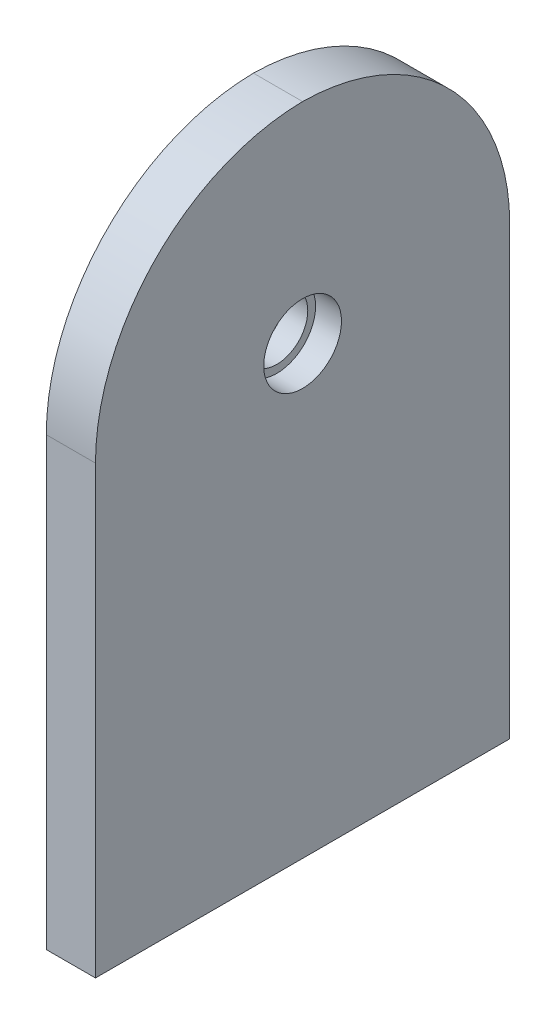
from build123d import *

# Parameters (mm, degrees)
STOCK_NEW_TRACKER_1_START = 60
STOCK_NEW_TRACKER_1_DEPTH = 8
SKETCH1_R                 = 7.509
CUT_EXTRUDE1_DEPTH        = 5
SKETCH2_R                 = 6
CUT_EXTRUDE2_DEPTH        = 143.418251296
BOSS_EXTRUDE1_START       = 1.5
SKETCH6_R                 = 6
BOSS_EXTRUDE1_DEPTH       = 1.5
M4X0_7_TAPPED_HOLE1_D     = 3.3
M4X0_7_TAPPED_HOLE1_DEPTH = 35
M4X0_7_TAPPED_HOLE1_TIP   = 0.991420021


# Read off the part's stored shape, not the designer's step: Stock-New_Tracker-1
with BuildPart() as part:
    # Stock-New_Tracker-1 outline → Stock-New_Tracker-1 (new body)
    with BuildSketch(Plane.YZ.offset(STOCK_NEW_TRACKER_1_START)):
        with BuildLine():
            Line((10, 40), (10, -40))
            Line((10, -40), (96.116983094, -40))
            ThreePointArc((96.116983094, -40), (124.570453884, -28.312888011), (136.594137144, 0))
            ThreePointArc((136.594137144, 0), (124.570453884, 28.312888011), (96.116983094, 40))
            Line((96.116983094, 40), (10, 40))
        make_face()
    extrude(amount=STOCK_NEW_TRACKER_1_DEPTH)

    # Sketch1 → Cut-Extrude1 (cut)
    with BuildSketch(Plane(origin=(68, 0, 0), x_dir=(0, 0, -1), z_dir=(1, 0, 0))):
        with Locations((0, 96.116983094)):
            Circle(SKETCH1_R)
    extrude(amount=-CUT_EXTRUDE1_DEPTH, mode=Mode.SUBTRACT)

    # Sketch2 → Cut-Extrude2 (cut, through all)
    with BuildSketch(Plane(origin=(63, 0, 0), x_dir=(0, 0, -1), z_dir=(1, 0, 0))):
        with Locations((0, 96.116983094)):
            Circle(SKETCH2_R)
    extrude(amount=-CUT_EXTRUDE2_DEPTH, mode=Mode.SUBTRACT)

    # Sketch6 → Boss-Extrude1 (add)
    with BuildSketch(Plane.ZY.offset(-60).offset(BOSS_EXTRUDE1_START)):
        with BuildLine():
            Line((-40, 96.116983094), (-40, 10))
            Line((-40, 10), (40, 10))
            Line((40, 10), (40, 96.116983094))
            ThreePointArc((40, 96.116983094), (28.312888011, 124.570453884), (0, 136.594137144))
            ThreePointArc((0, 136.594137144), (-28.312888011, 124.570453884), (-40, 96.116983094))
        make_face()
        with Locations(Location((0, 96.116983094, 0), (0, 0, 180))):
            Circle(SKETCH6_R, mode=Mode.SUBTRACT)
    extrude(amount=-BOSS_EXTRUDE1_DEPTH)

    # M4x0.7 Tapped Hole1
    with Locations(Plane(origin=(0, 10, 0), x_dir=(-1, 0, 0), z_dir=(0, -1, 0))):
        with Locations((-63.25, -30), (-63.25, 0), (-63.25, 30)):
            Hole(M4X0_7_TAPPED_HOLE1_D / 2, depth=M4X0_7_TAPPED_HOLE1_DEPTH)
            with Locations((0, 0, -(M4X0_7_TAPPED_HOLE1_DEPTH + M4X0_7_TAPPED_HOLE1_TIP / 2))):  # 118° drill point
                Cone(0, M4X0_7_TAPPED_HOLE1_D / 2, M4X0_7_TAPPED_HOLE1_TIP, mode=Mode.SUBTRACT)


solid = part.part
